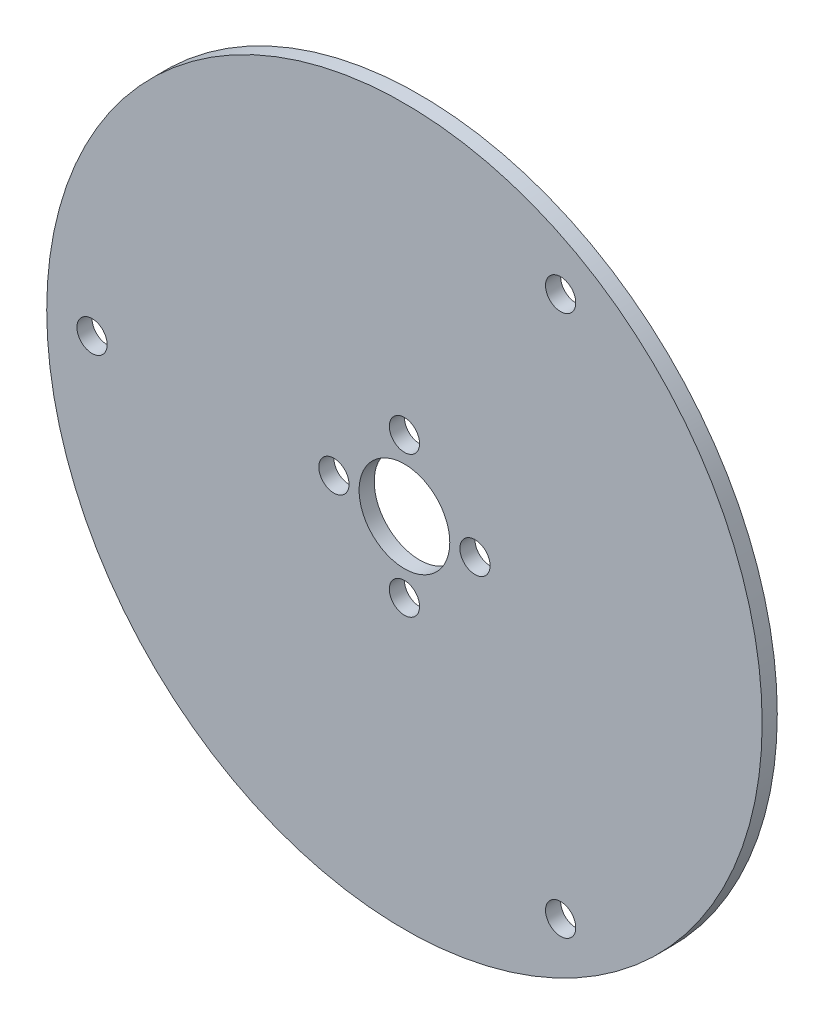
from build123d import *

# Parameters (mm, degrees)
SKETCH_1_R          = 35.5
EXTRUDE_1_DEPTH     = 1.5
SKETCH_2_R          = 4.5
CUT_EXTRUDE_1_DEPTH = 2
SKETCH_3_R          = 1.5
CUT_EXTRUDE_2_DEPTH = 2
SKETCH_5_R          = 1.5
CUT_EXTRUDE_3_DEPTH = 2


with BuildPart() as part:
    # 草图1 → 凸台-拉伸1 (new body)
    with BuildSketch(Plane.XY):
        Circle(SKETCH_1_R)
    extrude(amount=EXTRUDE_1_DEPTH)

    # 草图2 → 切除-拉伸1 (cut)
    with BuildSketch(Plane.XY.offset(1.5)):
        Circle(SKETCH_2_R)
    extrude(amount=-CUT_EXTRUDE_1_DEPTH, mode=Mode.SUBTRACT)

    # 草图3 → 切除-拉伸2 (cut)
    with BuildSketch(Plane.XY.offset(1.5)):
        with Locations((0, 7)):
            Circle(SKETCH_3_R)
        with Locations((7, 0)):
            Circle(SKETCH_3_R)
        with Locations((0, -7)):
            Circle(SKETCH_3_R)
        with Locations((-7, 0)):
            Circle(SKETCH_3_R)
    extrude(amount=-CUT_EXTRUDE_2_DEPTH, mode=Mode.SUBTRACT)

    # 草图5 → 切除-拉伸3 (cut)
    with BuildSketch(Plane.XY.offset(1.5)):
        with Locations((-31, 0)):
            Circle(SKETCH_5_R)
        with Locations((15.5, 26.846787517)):
            Circle(SKETCH_5_R)
        with Locations((15.5, -26.846787517)):
            Circle(SKETCH_5_R)
    extrude(amount=-CUT_EXTRUDE_3_DEPTH, mode=Mode.SUBTRACT)


solid = part.part
